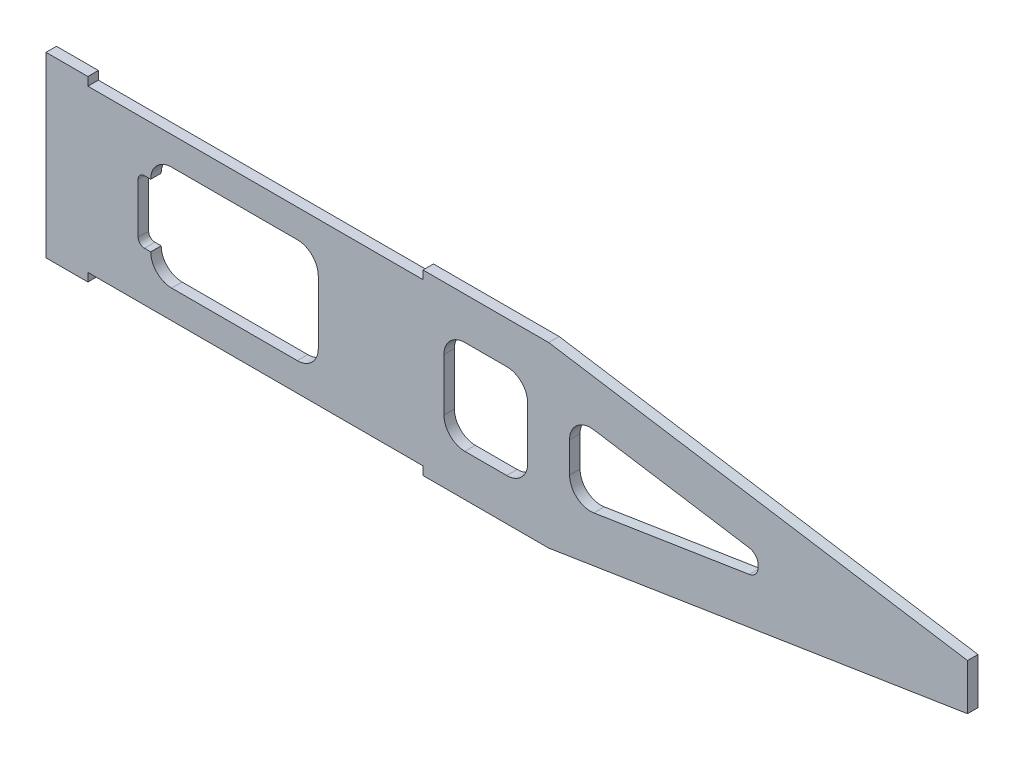
from build123d import *

# Parameters (mm, degrees)
GRUNDPLATTE_DEPTH                  = 5
SCHNITT_LINEAR_AUSTRAGEN1_DEPTH    = 443.076068115
VERRUNDUNG1_R                      = 10
SKIZZE3_W                          = 160
SKIZZE3_H                          = 4
AUSSCHNITT_FL_CHENAUFDOPPLER_DEPTH = 443.076068115
SKIZZE4_W                          = 40
SKIZZE4_H                          = 45
AUSSCHNITT_GEWICHT_DEPTH           = 443.076068115
VERRUNDUNG2_R                      = 10
VERRUNDUNG3_R                      = 5
VERRUNDUNG4_R                      = 3


with BuildPart() as part:
    # Skizze1 → Grundplatte (new body)
    with BuildSketch(Plane.XY):
        Polygon((0, 42.5), (0, -42.5), (240, -42.5), (440, -11), (440, 11), (240, 42.5), align=None)
    extrude(amount=GRUNDPLATTE_DEPTH)

    # Skizze2 → Schnitt-Linear austragen1 (cut, through all)
    with BuildSketch(Plane.XY.offset(5)):
        Polygon((130, 25), (50, 25), (50, 15), (44, 15), (44, -15), (50, -15), (50, -25), (130, -25), align=None)
    extrude(amount=-SCHNITT_LINEAR_AUSTRAGEN1_DEPTH, mode=Mode.SUBTRACT)

    # Verrundung1
    verrundung1_edges = [part.edges().sort_by_distance(p)[0] for p in [
        (130, 25, 2.5),
        (130, -25, 2.5),
        (50, 25, 2.5),
        (50, -25, 2.5),
    ]]
    fillet(verrundung1_edges, radius=VERRUNDUNG1_R - 0.0001)  # a hair under: the kernel refuses the full size

    # Skizze3 → Ausschnitt_Flächenaufdoppler (cut, through all)
    with BuildSketch(Plane.XY.offset(5)):
        with Locations((100, 40.5)):
            Rectangle(SKIZZE3_W, SKIZZE3_H)
        with Locations((100, -40.5)):
            Rectangle(SKIZZE3_W, SKIZZE3_H)
    extrude(amount=-AUSSCHNITT_FL_CHENAUFDOPPLER_DEPTH, mode=Mode.SUBTRACT)

    # Skizze4 → Ausschnitt Gewicht (cut, through all)
    with BuildSketch(Plane.XY.offset(5)):
        with Locations((210, 0)):
            Rectangle(SKIZZE4_W, SKIZZE4_H)
        Polygon((250, -19), (250, 19), (340, 4.825), (340, -4.825), align=None)
    extrude(amount=-AUSSCHNITT_GEWICHT_DEPTH, mode=Mode.SUBTRACT)

    # Verrundung2
    verrundung2_edges = [part.edges().sort_by_distance(p)[0] for p in [
        (190, 22.5, 2.5),
        (230, 22.5, 2.5),
        (230, -22.5, 2.5),
        (190, -22.5, 2.5),
        (250, -19, 2.5),
        (250, 19, 2.5),
    ]]
    fillet(verrundung2_edges, radius=VERRUNDUNG2_R)

    # Verrundung3
    verrundung3_edges = [part.edges().sort_by_distance(p)[0] for p in [
        (340, -4.825, 2.5),
        (340, 4.825, 2.5),
    ]]
    fillet(verrundung3_edges, radius=VERRUNDUNG3_R)

    # Verrundung4
    verrundung4_edges = [part.edges().sort_by_distance(p)[0] for p in [
        (44, -15, 2.5),
        (44, 15, 2.5),
    ]]
    fillet(verrundung4_edges, radius=VERRUNDUNG4_R)


solid = part.part
